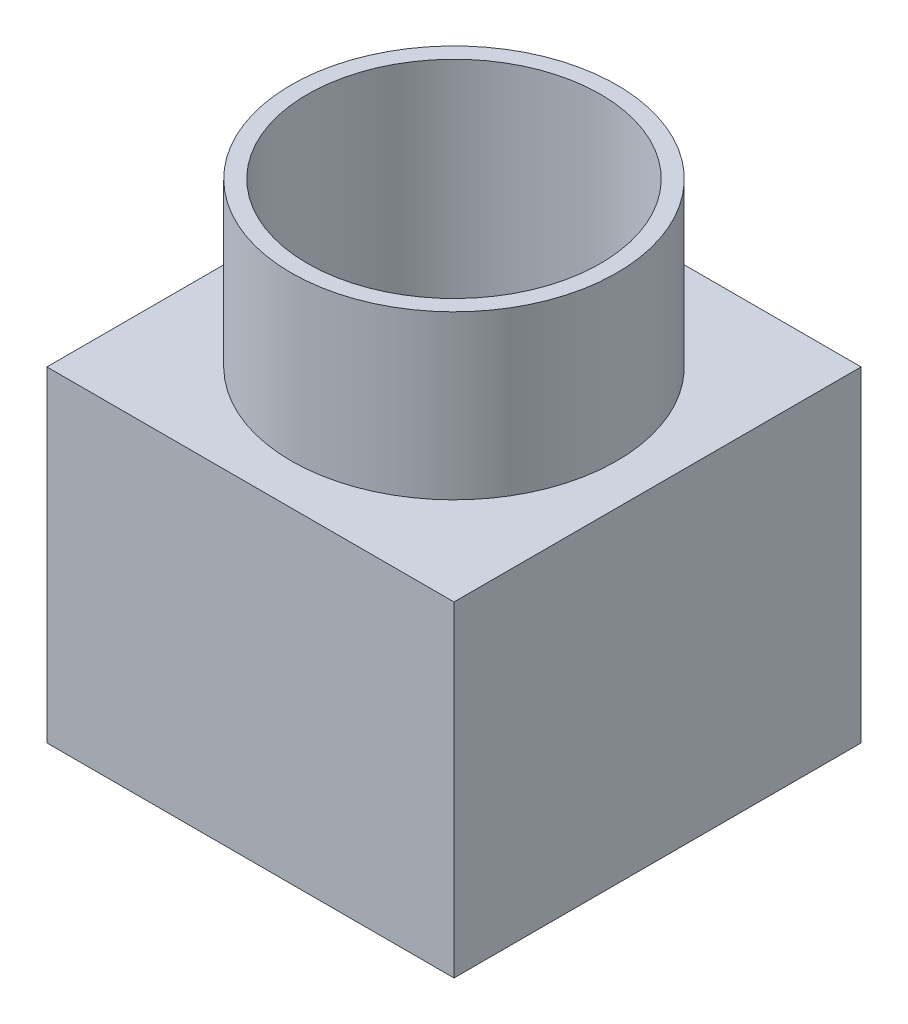
from build123d import *

# Parameters (mm, degrees)
CROQUIS1_W              = 25
CROQUIS1_H              = 25
SALIENTE_EXTRUIR1_DEPTH = 20
CROQUIS2_R              = 10
SALIENTE_EXTRUIR2_DEPTH = 10
CROQUIS3_R              = 9
CORTAR_EXTRUIR1_DEPTH   = 20
VACIADO2_OUTLINE_W      = 23
VACIADO2_OUTLINE_H      = 21
VACIADO2_DEPTH          = 9
VACIADO2_START          = 9
VACIADO2_2_OUTLINE_W    = 23
VACIADO2_2_OUTLINE_H    = 21
VACIADO2_2_OUTLINE_R    = 10
VACIADO2_2_DEPTH        = 10


# Read off the part's stored shape, not the designer's step: Vaciado2
with BuildPart() as part:
    # Croquis1 → Saliente-Extruir1 (new body)
    with BuildSketch(Plane(origin=(0, 0, 0), x_dir=(1, 0, 0), z_dir=(0, 1, 0))):
        Rectangle(CROQUIS1_W, CROQUIS1_H)
    extrude(amount=SALIENTE_EXTRUIR1_DEPTH)

    # Croquis2 → Saliente-Extruir2 (add)
    with BuildSketch(Plane(origin=(0, 20, 0), x_dir=(1, 0, 0), z_dir=(0, 1, 0))):
        with Locations(Location((0, 0, 0), (0, 0, 270))):
            Circle(CROQUIS2_R)
    extrude(amount=SALIENTE_EXTRUIR2_DEPTH)

    # Croquis3 → Cortar-Extruir1 (cut)
    with BuildSketch(Plane(origin=(0, 30, 0), x_dir=(1, 0, 0), z_dir=(0, 1, 0))):
        with Locations(Location((0, 0, 0), (0, 0, 270))):
            Circle(CROQUIS3_R)
    extrude(amount=-CORTAR_EXTRUIR1_DEPTH, mode=Mode.SUBTRACT)

    # Vaciado2 outline → Vaciado2 (cut)
    with BuildSketch(Plane(origin=(0, 0, 0), x_dir=(1, 0, 0), z_dir=(0, 1, 0))):
        Rectangle(VACIADO2_OUTLINE_W, VACIADO2_OUTLINE_H)
    extrude(amount=VACIADO2_DEPTH, mode=Mode.SUBTRACT)

    # Vaciado2 2 outline → Vaciado2 2 (cut)
    with BuildSketch(Plane(origin=(0, 0, 0), x_dir=(1, 0, 0), z_dir=(0, 1, 0)).offset(VACIADO2_START)):
        Rectangle(VACIADO2_2_OUTLINE_W, VACIADO2_2_OUTLINE_H)
        Circle(VACIADO2_2_OUTLINE_R, mode=Mode.SUBTRACT)
    extrude(amount=VACIADO2_2_DEPTH, mode=Mode.SUBTRACT)


solid = part.part
